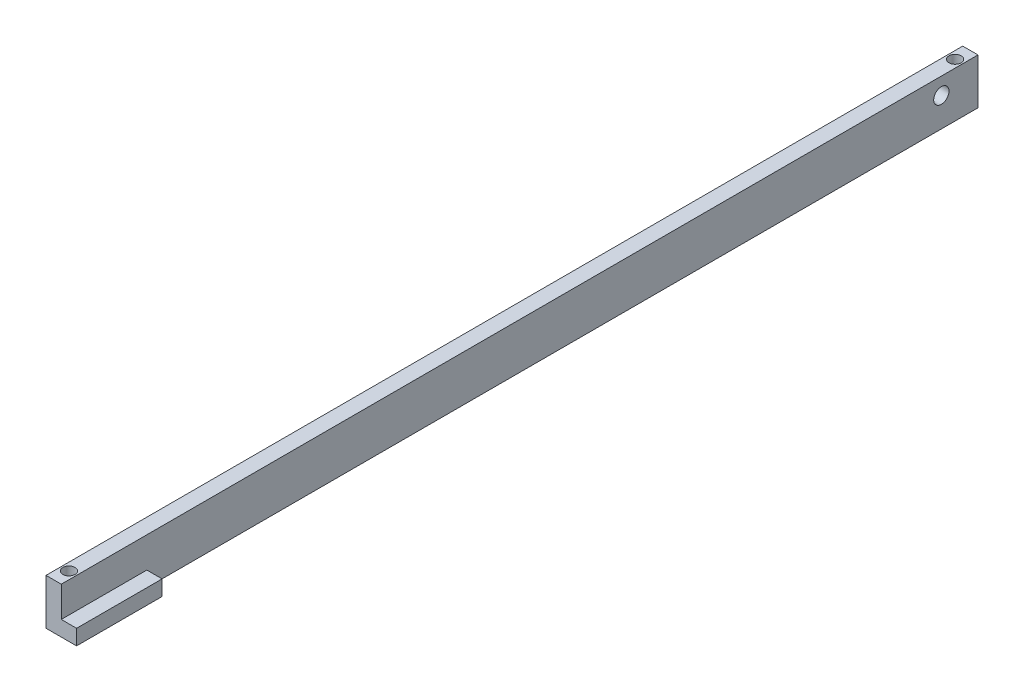
from build123d import *

# Parameters (mm, degrees)
BOSS_EXTRUDE1_DEPTH = 381
CUT_EXTRUDE1_REACH  = 383.687
SKETCH2_R           = 3.175
SKETCH3_R           = 2.54
CUT_EXTRUDE2_DEPTH  = 7.62
CUT_EXTRUDE3_START  = -7.62
SKETCH4_R           = 2.54
CUT_EXTRUDE3_DEPTH  = 7.62
SKETCH5_W           = 6.35
SKETCH5_H           = 6.35
CUT_EXTRUDE4_DEPTH  = 345.44


with BuildPart() as part:
    # Sketch1 → Boss-Extrude1 (new body)
    with BuildSketch(Plane.XY):
        Polygon((0, 0), (-12.7, 0), (-12.7, 19.05), (-6.35, 19.05), (-6.35, 6.35), (0, 6.35), align=None)
    extrude(amount=-BOSS_EXTRUDE1_DEPTH)

    # Sketch2 → Cut-Extrude1 (cut, up to next)
    with BuildSketch(Plane.ZY.offset(12.7), mode=Mode.PRIVATE) as cut_extrude1_sk1:
        with Locations((-365.76, 12.065)):
            Circle(SKETCH2_R)
    cut_extrude1_tool1 = extrude(cut_extrude1_sk1.sketch, amount=-CUT_EXTRUDE1_REACH, mode=Mode.PRIVATE) & part.part
    add(cut_extrude1_tool1.solids().sort_by_distance((-12.7, 12.065, -365.76))[0], mode=Mode.SUBTRACT)

    # Sketch3 → Cut-Extrude2 (cut)
    with BuildSketch(Plane(origin=(0, 19.05, 0), x_dir=(1, 0, 0), z_dir=(0, 1, 0))):
        with Locations((-9.525, 6.35)):
            Circle(SKETCH3_R)
        with Locations((-9.525, 374.65)):
            Circle(SKETCH3_R)
    extrude(amount=-CUT_EXTRUDE2_DEPTH, mode=Mode.SUBTRACT)

    # Sketch4 → Cut-Extrude3 (cut)
    with BuildSketch(Plane.XZ.offset(CUT_EXTRUDE3_START)):
        with Locations((-9.525, -374.65)):
            Circle(SKETCH4_R)
        with Locations((-9.525, -6.35)):
            Circle(SKETCH4_R)
    extrude(amount=CUT_EXTRUDE3_DEPTH, mode=Mode.SUBTRACT)

    # Sketch5 → Cut-Extrude4 (cut)
    with BuildSketch(Plane(origin=(0, 0, -381), x_dir=(-1, 0, 0), z_dir=(0, 0, -1))):
        with Locations((3.175, 3.175)):
            Rectangle(SKETCH5_W, SKETCH5_H)
    extrude(amount=-CUT_EXTRUDE4_DEPTH, mode=Mode.SUBTRACT)


solid = part.part
